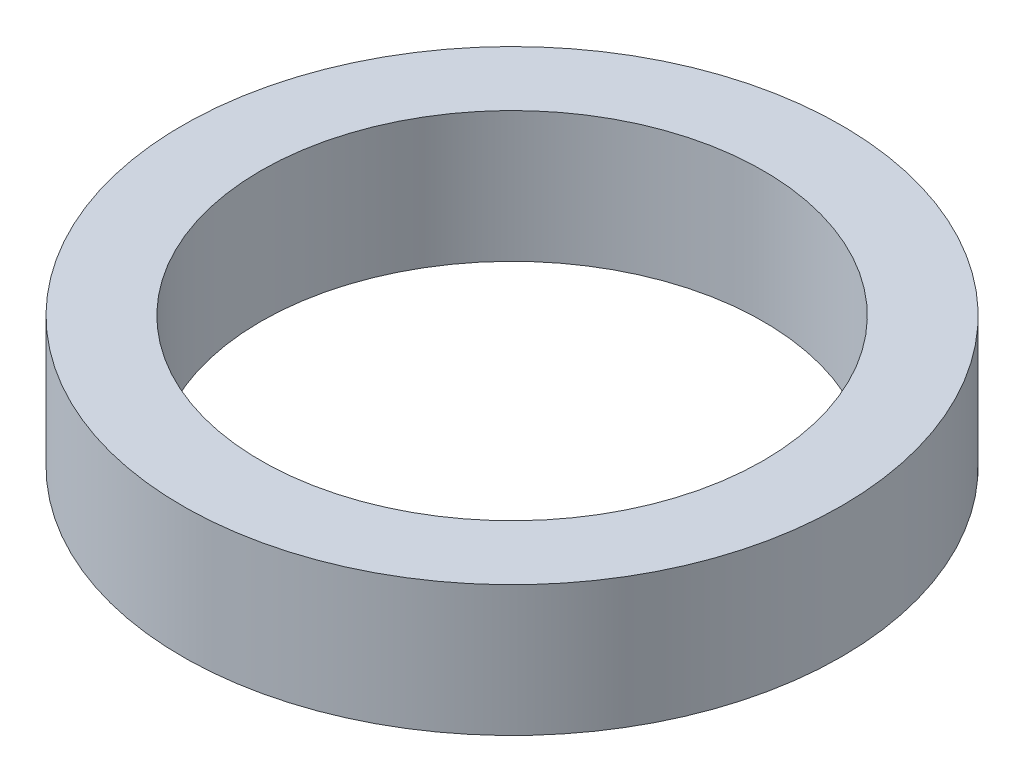
from build123d import *

# Parameters (mm, degrees)
BOSS_EXTRUDE1_OUTLINE_R   = 25.234452235
BOSS_EXTRUDE1_OUTLINE_R_2 = 19.234452235
BOSS_EXTRUDE1_DEPTH       = 10


# Read off the part's stored shape, not the designer's step: Boss-Extrude1
with BuildPart() as part:
    # Boss-Extrude1 outline → Boss-Extrude1 (new body)
    with BuildSketch(Plane.XZ.offset(-170.330120992)):
        with Locations((-27.085308561, 0)):
            Circle(BOSS_EXTRUDE1_OUTLINE_R)
        with Locations((-27.085308561, 0)):
            Circle(BOSS_EXTRUDE1_OUTLINE_R_2, mode=Mode.SUBTRACT)
    extrude(amount=BOSS_EXTRUDE1_DEPTH)


solid = part.part
